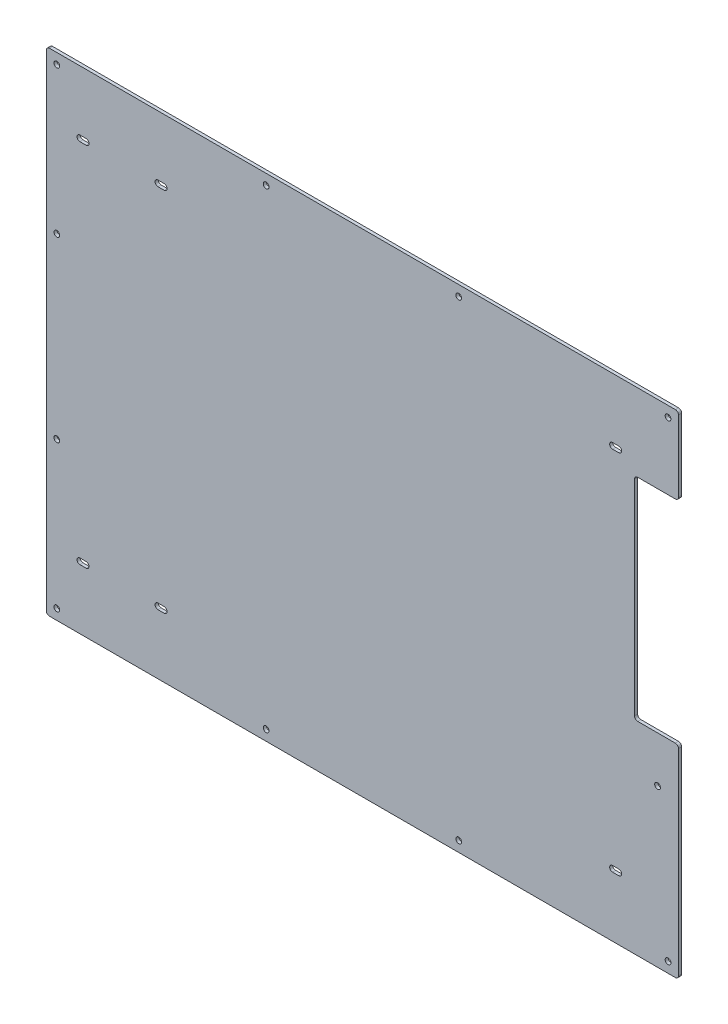
from build123d import *

# Parameters (mm, degrees)
SKETCH1_W                         = 604
SKETCH1_H                         = 470
BOSS_EXTRUDE1_DEPTH               = 3
FILLET1_R                         = 3
M5_CLEARANCE_HOLE1_D              = 5.5
M5_MANUFACTURING_FIXTURING_HOLE_D = 5.5
CUT_EXTRUDE5_DEPTH                = 766.326727614
SKETCH6_W                         = 42
SKETCH6_H                         = 202
CUT_EXTRUDE2_DEPTH                = 766.326727614
FILLET3_R                         = 3


with BuildPart() as part:
    # Sketch1 → Boss-Extrude1 (new body)
    with BuildSketch(Plane.XY):
        with Locations((302, 235)):
            Rectangle(SKETCH1_W, SKETCH1_H)
    extrude(amount=BOSS_EXTRUDE1_DEPTH)

    # Fillet1
    fillet1_edges = [part.edges().sort_by_distance(p)[0] for p in [
        (0, 0, 1.5),
        (604, 0, 1.5),
        (0, 470, 1.5),
        (604, 470, 1.5),
    ]]
    fillet(fillet1_edges, radius=FILLET1_R)

    # M5 Clearance Hole1 (through all)
    with Locations(Plane(origin=(0, 0, 0), x_dir=(-1, 0, 0), z_dir=(0, 0, -1))):
        with Locations((-594, 460), (-394, 460), (-210, 460), (-10, 460), (-10, 10), (-210, 10), (-394, 10), (-594, 10), (-544, 410), (-544, 60), (-35, 410), (-35, 60), (-109.625, 410), (-109.625, 60)):
            Hole(M5_CLEARANCE_HOLE1_D / 2)

    # M5 Manufacturing Fixturing Hole (through all)
    with Locations(Plane.XY.offset(3)):
        with Locations((10, 320), (10, 150), (584, 320), (584, 150)):
            Hole(M5_MANUFACTURING_FIXTURING_HOLE_D / 2)

    # Sketch9 → Cut-Extrude5 (cut, through all)
    with BuildSketch(Plane.XY.offset(3)):
        with BuildLine():
            Line((32, 412.75), (38, 412.75))
            ThreePointArc((38, 412.75), (40.75, 410), (38, 407.25))
            Line((38, 407.25), (32, 407.25))
            ThreePointArc((32, 407.25), (29.25, 410), (32, 412.75))
        make_face()
        with BuildLine():
            Line((106.625, 412.75), (112.625, 412.75))
            ThreePointArc((112.625, 412.75), (115.375, 410), (112.625, 407.25))
            Line((112.625, 407.25), (106.625, 407.25))
            ThreePointArc((106.625, 407.25), (103.875, 410), (106.625, 412.75))
        make_face()
        with BuildLine():
            Line((32, 62.75), (38, 62.75))
            ThreePointArc((38, 62.75), (40.75, 60), (38, 57.25))
            Line((38, 57.25), (32, 57.25))
            ThreePointArc((32, 57.25), (29.25, 60), (32, 62.75))
        make_face()
        with BuildLine():
            Line((106.625, 62.75), (112.625, 62.75))
            ThreePointArc((112.625, 62.75), (115.375, 60), (112.625, 57.25))
            Line((112.625, 57.25), (106.625, 57.25))
            ThreePointArc((106.625, 57.25), (103.875, 60), (106.625, 62.75))
        make_face()
        with BuildLine():
            Line((541, 412.75), (547, 412.75))
            ThreePointArc((547, 412.75), (549.75, 410), (547, 407.25))
            Line((547, 407.25), (541, 407.25))
            ThreePointArc((541, 407.25), (538.25, 410), (541, 412.75))
        make_face()
        with BuildLine():
            Line((541, 62.75), (547, 62.75))
            ThreePointArc((547, 62.75), (549.75, 60), (547, 57.25))
            Line((547, 57.25), (541, 57.25))
            ThreePointArc((541, 57.25), (538.25, 60), (541, 62.75))
        make_face()
    extrude(amount=-CUT_EXTRUDE5_DEPTH, mode=Mode.SUBTRACT)

    # Sketch6 → Cut-Extrude2 (cut, through all)
    with BuildSketch(Plane.XY.offset(3)):
        with Locations((583, 295)):
            Rectangle(SKETCH6_W, SKETCH6_H)
    extrude(amount=-CUT_EXTRUDE2_DEPTH, mode=Mode.SUBTRACT)

    # Fillet3
    fillet3_edges = [part.edges().sort_by_distance(p)[0] for p in [
        (562, 194, 1.5),
        (562, 396, 1.5),
        (604, 194, 1.5),
        (604, 396, 1.5),
    ]]
    fillet(fillet3_edges, radius=FILLET3_R)


solid = part.part
